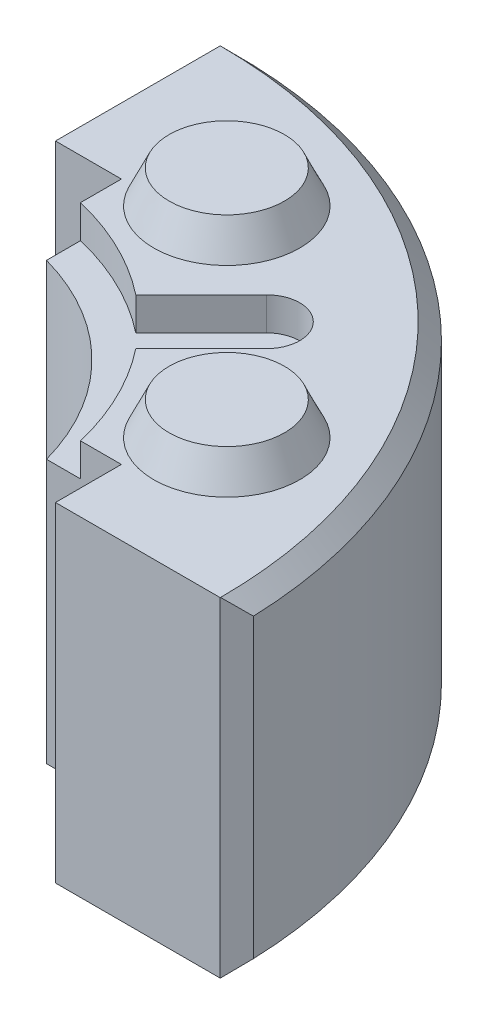
from build123d import *

# Parameters (mm, degrees)
BOSS_EXTRUDE1_DEPTH           = 100
SKETCH3_R                     = 17.5
BOSS_EXTRUDE3_DEPTH           = 10
BOSS_EXTRUDE3_DRAFT           = 25
BOSS_EXTRUDE3_PROFILE_2_DEPTH = 10
BOSS_EXTRUDE3_PROFILE_2_DRAFT = 25
SKETCH4_R                     = 18
CUT_EXTRUDE1_DEPTH            = 11
CUT_EXTRUDE1_DRAFT            = -25
CUT_EXTRUDE1_PROFILE_2_DEPTH  = 11
CUT_EXTRUDE1_PROFILE_2_DRAFT  = -25
SKETCH5_W                     = 40
SKETCH5_H                     = 40
CUT_EXTRUDE2_DEPTH            = 144
SKETCH6_R                     = 85
CUT_EXTRUDE3_DEPTH            = 10
CUT_EXTRUDE4_START            = -10
SKETCH7_R                     = 85
CUT_EXTRUDE4_DEPTH            = 10
CUT_EXTRUDE5_DEPTH            = 10
CUT_EXTRUDE6_START            = -10
CUT_EXTRUDE6_DEPTH            = 10


with BuildPart() as part:
    # Sketch1 → Boss-Extrude1 (new body)
    with BuildSketch(Plane(origin=(0, 0, 0), x_dir=(1, 0, 0), z_dir=(0, 1, 0))):
        with BuildLine():
            Line((0, 150), (0, 75))
            ThreePointArc((0, 75), (53.033008589, 53.033008589), (75, 0))
            Line((75, 0), (150, 0))
            ThreePointArc((150, 0), (106.066017178, 106.066017178), (0, 150))
        make_face()
    extrude(amount=BOSS_EXTRUDE1_DEPTH)


with BuildPart() as boss_extrude3_tool:
    # Sketch3 → Boss-Extrude3 (with draft: the straight prism first)
    with BuildSketch(Plane(origin=(0, 110, 0), x_dir=(1, 0, 0), z_dir=(0, 1, 0))):
        with Locations((43.051886141, 103.936447408)):
            Circle(SKETCH3_R)
    extrude(amount=-BOSS_EXTRUDE3_DEPTH)
    # Boss-Extrude3: the draft: its side faces are tilted about the plane it starts from
    boss_extrude3_sides = [boss_extrude3_tool.faces().sort_by_distance(p)[0] for p in [
        (25.551886141, 105, -103.936447408),
    ]]
    draft(boss_extrude3_sides, Plane(origin=(0, 110, 0), x_dir=(1, 0, 0), z_dir=(0, 1, 0)), BOSS_EXTRUDE3_DRAFT)


with BuildPart() as part_1:
    add(part.part)

    # Boss-Extrude3: add boss_extrude3_tool
    add(boss_extrude3_tool.part)


with BuildPart() as boss_extrude3_profile_2_tool:
    # Sketch3 → Boss-Extrude3 profile 2 (with draft: the straight prism first)
    with BuildSketch(Plane(origin=(0, 110, 0), x_dir=(1, 0, 0), z_dir=(0, 1, 0))):
        with Locations((103.936447408, 43.051886141)):
            Circle(SKETCH3_R)
    extrude(amount=-BOSS_EXTRUDE3_PROFILE_2_DEPTH)
    # Boss-Extrude3 profile 2: the draft: its side faces are tilted about the plane it starts from
    boss_extrude3_profile_2_sides = [boss_extrude3_profile_2_tool.faces().sort_by_distance(p)[0] for p in [
        (86.436447408, 105, -43.051886141),
    ]]
    draft(boss_extrude3_profile_2_sides, Plane(origin=(0, 110, 0), x_dir=(1, 0, 0), z_dir=(0, 1, 0)), BOSS_EXTRUDE3_PROFILE_2_DRAFT)


with BuildPart() as part_2:
    add(part_1.part)

    # Boss-Extrude3 profile 2: add boss_extrude3_profile_2_tool
    add(boss_extrude3_profile_2_tool.part)


with BuildPart() as cut_extrude1_tool:
    # Sketch4 → Cut-Extrude1 (with draft: the straight prism first)
    with BuildSketch(Plane.XZ):
        with Locations((103.936447408, -43.051886141)):
            Circle(SKETCH4_R)
    extrude(amount=-CUT_EXTRUDE1_DEPTH)
    # Cut-Extrude1: the draft: its side faces are tilted about the plane it starts from
    cut_extrude1_sides = [cut_extrude1_tool.faces().sort_by_distance(p)[0] for p in [
        (85.936447408, 5.5, -43.051886141),
    ]]
    draft(cut_extrude1_sides, Plane.XZ, CUT_EXTRUDE1_DRAFT)


with BuildPart() as part_3:
    add(part_2.part)

    # Cut-Extrude1: cut by cut_extrude1_tool
    add(cut_extrude1_tool.part, mode=Mode.SUBTRACT)


with BuildPart() as cut_extrude1_profile_2_tool:
    # Sketch4 → Cut-Extrude1 profile 2 (with draft: the straight prism first)
    with BuildSketch(Plane.XZ):
        with Locations((43.051886141, -103.936447408)):
            Circle(SKETCH4_R)
    extrude(amount=-CUT_EXTRUDE1_PROFILE_2_DEPTH)
    # Cut-Extrude1 profile 2: the draft: its side faces are tilted about the plane it starts from
    cut_extrude1_profile_2_sides = [cut_extrude1_profile_2_tool.faces().sort_by_distance(p)[0] for p in [
        (25.051886141, 5.5, -103.936447408),
    ]]
    draft(cut_extrude1_profile_2_sides, Plane.XZ, CUT_EXTRUDE1_PROFILE_2_DRAFT)


with BuildPart() as part_4:
    add(part_3.part)

    # Cut-Extrude1 profile 2: cut by cut_extrude1_profile_2_tool
    add(cut_extrude1_profile_2_tool.part, mode=Mode.SUBTRACT)

    # Sketch5 → Cut-Extrude2 (cut)
    with BuildSketch(Plane.XZ):
        with Locations((0, -75)):
            Rectangle(SKETCH5_W, SKETCH5_H)
        with Locations((75, 0)):
            Rectangle(SKETCH5_W, SKETCH5_H)
    extrude(amount=-CUT_EXTRUDE2_DEPTH, mode=Mode.SUBTRACT)

    # Chamfer1
    # the kernel refuses this chamfer: 5 mm, written as the material it takes off along each edge
    with BuildSketch(Plane(origin=(0, 100, 0), x_dir=(0.9963251041879452, 0, 0.08565212644692502), z_dir=(-0.08565212644692502, 0, 0.9963251041879452))) as chamfer1_piece_1:
        with BuildLine():
            Line((150.141421356, -5.141421356), (144.858578644, 0.141421356))
            Line((144.858578644, 0.141421356), (144.858578644, 0.241421356))
            ThreePointArc((144.858578644, 0.241421356), (147.429289322, 0.1), (150, 0.1))
            Line((150, 0.1), (150.1, 0))
            ThreePointArc((150.1, 0), (150.1, -2.570710678), (150.241421356, -5.141421356))
            Line((150.241421356, -5.141421356), (150.141421356, -5.141421356))
        make_face()
    revolve(axis=Axis((0, 100, 0), (0, 1, 0)), revolution_arc=99.827051452, mode=Mode.SUBTRACT)
    with BuildSketch(Plane(origin=(0, 0, 0), x_dir=(0.9963251041879452, 0, 0.08565212644692488), z_dir=(-0.08565212644692488, 0, 0.9963251041879452))) as chamfer1_piece_2:
        with BuildLine():
            Line((150.141421356, 5.141421356), (144.858578644, -0.141421356))
            Line((144.858578644, -0.141421356), (144.858578644, -0.241421356))
            ThreePointArc((144.858578644, -0.241421356), (147.429289322, -0.1), (150, -0.1))
            Line((150, -0.1), (150.1, 0))
            ThreePointArc((150.1, 0), (150.1, 2.570710678), (150.241421356, 5.141421356))
            Line((150.241421356, 5.141421356), (150.141421356, 5.141421356))
        make_face()
    revolve(axis=Axis((0, 0, 0), (0, 1, 0)), revolution_arc=99.827051452, mode=Mode.SUBTRACT)
    with BuildSketch(Plane(origin=(150, -13.291214034, 0), x_dir=(0.009358737420086232, 0, -0.9999562060579963), z_dir=(0, 1, 0))) as chamfer1_piece_3:
        with BuildLine():
            Line((5.316485613, 0), (-0.192733912, 5.223619222))
            Line((-0.192733912, 5.223619222), (-0.292729532, 5.222683348))
            ThreePointArc((-0.292729532, 5.222683348), (-0.124446231, 2.611546813), (-0.099995621, -0.000935874))
            Line((-0.099995621, -0.000935874), (0.000935874, -0.099995621))
            ThreePointArc((0.000935874, -0.099995621), (2.659639048, -0.051556934), (5.320869055, -0.099903881))
            Line((5.320869055, -0.099903881), (5.316485613, 0))
        make_face()
    extrude(amount=126.582428067, mode=Mode.SUBTRACT)
    with BuildSketch(Plane(origin=(0, -13.291214034, -150), x_dir=(0.9999562060579963, 0, -0.009358737420086213), z_dir=(0, 1, 0))) as chamfer1_piece_4:
        with BuildLine():
            Line((5.316485613, 0), (-0.192733912, -5.223619222))
            Line((-0.192733912, -5.223619222), (-0.292729532, -5.222683348))
            ThreePointArc((-0.292729532, -5.222683348), (-0.124446231, -2.611546813), (-0.099995621, 0.000935874))
            Line((-0.099995621, 0.000935874), (0.000935874, 0.099995621))
            ThreePointArc((0.000935874, 0.099995621), (2.659639048, 0.051556934), (5.320869055, 0.099903881))
            Line((5.320869055, 0.099903881), (5.316485613, 0))
        make_face()
    extrude(amount=126.582428067, mode=Mode.SUBTRACT)

    # Sketch6 → Cut-Extrude3 (cut)
    with BuildSketch(Plane(origin=(0, 100, 0), x_dir=(1, 0, 0), z_dir=(0, 1, 0))):
        Circle(SKETCH6_R)
    extrude(amount=-CUT_EXTRUDE3_DEPTH, mode=Mode.SUBTRACT)

    # Sketch7 → Cut-Extrude4 (cut)
    with BuildSketch(Plane.XZ.offset(CUT_EXTRUDE4_START)):
        Circle(SKETCH7_R)
    extrude(amount=CUT_EXTRUDE4_DEPTH, mode=Mode.SUBTRACT)

    # Sketch8 → Cut-Extrude5 (cut)
    with BuildSketch(Plane(origin=(0, 100, 0), x_dir=(1, 0, 0), z_dir=(0, 1, 0))):
        with BuildLine():
            Line((66.757749743, 52.61561412), (86.620580695, 72.478445072))
            ThreePointArc((86.620580695, 72.478445072), (86.620580695, 86.620580695), (72.478445072, 86.620580695))
            Line((72.478445072, 86.620580695), (52.61561412, 66.757749743))
            ThreePointArc((52.61561412, 66.757749743), (60.104076401, 60.104076401), (66.757749743, 52.61561412))
        make_face()
    extrude(amount=-CUT_EXTRUDE5_DEPTH, mode=Mode.SUBTRACT)

    # Sketch10 → Cut-Extrude6 (cut)
    with BuildSketch(Plane.XZ.offset(CUT_EXTRUDE6_START)):
        with BuildLine():
            Line((86.620580695, -72.478445072), (66.757749743, -52.61561412))
            ThreePointArc((66.757749743, -52.61561412), (60.104076401, -60.104076401), (52.61561412, -66.757749743))
            Line((52.61561412, -66.757749743), (72.478445072, -86.620580695))
            ThreePointArc((72.478445072, -86.620580695), (86.620580695, -86.620580695), (86.620580695, -72.478445072))
        make_face()
    extrude(amount=CUT_EXTRUDE6_DEPTH, mode=Mode.SUBTRACT)


solid = part_4.part
